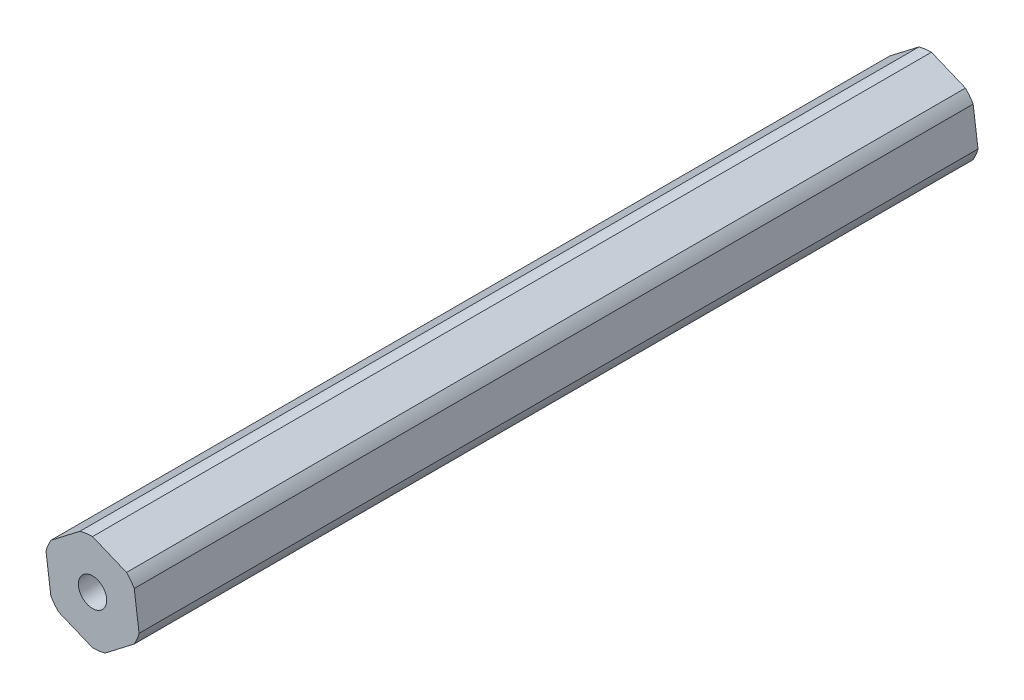
from build123d import *

# Parameters (mm, degrees)
BOSS_EXTRUDE1_DEPTH        = 119.6975
F_10_32_TAPPED_HOLE2_D     = 4.0386
F_10_32_TAPPED_HOLE2_DEPTH = 13.6144
F_10_32_TAPPED_HOLE2_TIP   = 1.213317848
F_10_32_TAPPED_HOLE4_D     = 4.0386
F_10_32_TAPPED_HOLE4_DEPTH = 15.0876
F_10_32_TAPPED_HOLE4_TIP   = 1.213317848


with BuildPart() as part:
    # Sketch1 → Boss-Extrude1 (new body)
    with BuildSketch(Plane.XY):
        with BuildLine():
            Line((-1.789892893, 6.63346078), (-5.950200742, 3.43535))
            ThreePointArc((-5.950200742, 3.43535), (-6.35, 2.623741315), (-6.639691997, 1.766637675))
            Line((-6.639691997, 1.766637675), (-5.950200742, -3.43535))
            ThreePointArc((-5.950200742, -3.43535), (-5.447226632, -4.187390656), (-4.849799104, -4.866823105))
            Line((-4.849799104, -4.866823105), (0, -6.8707))
            ThreePointArc((0, -6.8707), (0.902773368, -6.811131972), (1.789892893, -6.63346078))
            Line((1.789892893, -6.63346078), (5.950200742, -3.43535))
            ThreePointArc((5.950200742, -3.43535), (6.35, -2.623741315), (6.639691997, -1.766637675))
            Line((6.639691997, -1.766637675), (5.950200742, 3.43535))
            ThreePointArc((5.950200742, 3.43535), (5.447226632, 4.187390656), (4.849799104, 4.866823105))
            Line((4.849799104, 4.866823105), (0, 6.8707))
            ThreePointArc((0, 6.8707), (-0.902773368, 6.811131972), (-1.789892893, 6.63346078))
        make_face()
    extrude(amount=BOSS_EXTRUDE1_DEPTH)

    # #10-32 Tapped Hole2
    with Locations(Plane.XY.offset(119.6975)):
        with Locations((0, 0)):
            Hole(F_10_32_TAPPED_HOLE2_D / 2, depth=F_10_32_TAPPED_HOLE2_DEPTH)
            with Locations((0, 0, -(F_10_32_TAPPED_HOLE2_DEPTH + F_10_32_TAPPED_HOLE2_TIP / 2))):  # 118° drill point
                Cone(0, F_10_32_TAPPED_HOLE2_D / 2, F_10_32_TAPPED_HOLE2_TIP, mode=Mode.SUBTRACT)

    # #10-32 Tapped Hole4
    with Locations(Plane(origin=(0, 0, 0), x_dir=(-1, 0, 0), z_dir=(0, 0, -1))):
        with Locations((0, 0)):
            Hole(F_10_32_TAPPED_HOLE4_D / 2, depth=F_10_32_TAPPED_HOLE4_DEPTH)
            with Locations((0, 0, -(F_10_32_TAPPED_HOLE4_DEPTH + F_10_32_TAPPED_HOLE4_TIP / 2))):  # 118° drill point
                Cone(0, F_10_32_TAPPED_HOLE4_D / 2, F_10_32_TAPPED_HOLE4_TIP, mode=Mode.SUBTRACT)


solid = part.part
